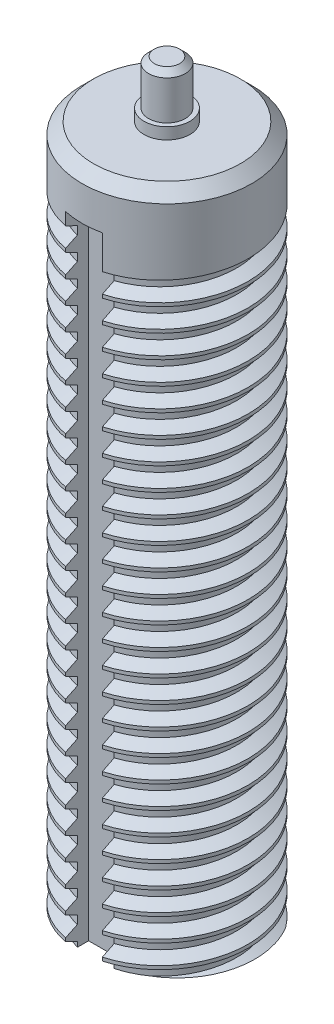
from build123d import *

# Parameters (mm, degrees)
BOSS_EXTRUDE1_DEPTH     = 70
BOSS_EXTRUDE2_START     = -4
SKETCH2_R               = 7.4
BOSS_EXTRUDE2_DEPTH     = 4
SKETCH3_R               = 2
BOSS_EXTRUDE3_DEPTH     = 1
SKETCH4_R               = 1.6
BOSS_EXTRUDE4_DEPTH     = 3.9
CHAMFER1_SIZE           = 0.5
CHAMFER2_SIZE           = 1
CUT_SWEEP2_PITCH        = 2
CUT_EXTRUDE1_DEPTH      = 76.627574787
CUT_EXTRUDE1_DEPTH_BACK = 76.627574787
SKETCH8_W               = 32.067903325
SKETCH8_H               = 12.666319182


with BuildPart() as part:
    # Sketch1 → Boss-Extrude1 (new body)
    with BuildSketch(Plane(origin=(0, 0, 0), x_dir=(1, 0, 0), z_dir=(0, 1, 0))):
        with BuildLine():
            Line((-1.6, 7.224956747), (-1.6, 5.224956747))
            Line((-1.6, 5.224956747), (1.6, 5.224956747))
            Line((1.6, 5.224956747), (1.6, 7.224956747))
            ThreePointArc((1.6, 7.224956747), (7.4, 0), (1.6, -7.224956747))
            Line((1.6, -7.224956747), (1.6, -5.224956747))
            Line((1.6, -5.224956747), (-1.6, -5.224956747))
            Line((-1.6, -5.224956747), (-1.6, -7.224956747))
            ThreePointArc((-1.6, -7.224956747), (-7.4, 0), (-1.6, 7.224956747))
        make_face()
    extrude(amount=BOSS_EXTRUDE1_DEPTH)

    # Sketch2 → Boss-Extrude2 (add)
    with BuildSketch(Plane(origin=(0, 70, 0), x_dir=(1, 0, 0), z_dir=(0, 1, 0)).offset(BOSS_EXTRUDE2_START)):
        with Locations(Location((0, 0, 0), (0, 0, 102.486889814))):
            Circle(SKETCH2_R)
    extrude(amount=BOSS_EXTRUDE2_DEPTH)

    # Sketch3 → Boss-Extrude3 (add)
    with BuildSketch(Plane(origin=(0, 70, 0), x_dir=(1, 0, 0), z_dir=(0, 1, 0))):
        with Locations(Location((0, 0, 0), (0, 0, 270))):
            Circle(SKETCH3_R)
    extrude(amount=BOSS_EXTRUDE3_DEPTH)

    # Sketch4 → Boss-Extrude4 (add)
    with BuildSketch(Plane(origin=(0, 71, 0), x_dir=(1, 0, 0), z_dir=(0, 1, 0))):
        with Locations(Location((0, 0, 0), (0, 0, 270))):
            Circle(SKETCH4_R)
    extrude(amount=BOSS_EXTRUDE4_DEPTH)

    # Chamfer1
    chamfer1_edges = [part.edges().sort_by_distance(p)[0] for p in [
        (0, 74.9, -1.6),
    ]]
    chamfer(chamfer1_edges, length=CHAMFER1_SIZE)

    # Chamfer2
    chamfer2_edges = [part.edges().sort_by_distance(p)[0] for p in [
        (7.4, 70, 0),
    ]]
    chamfer(chamfer2_edges, length=CHAMFER2_SIZE)

    # Cut-Sweep2: the profile of Sketch6 profile screwed along a right-hand helix of 32.5 turns, 10 arcs to a turn; built about Z, then put on its axis
    cut_sweep2_z = Axis((0, 0, 0), (0, 0, 1))
    cut_sweep2_corners = [(7.4003, 0, 0.00015), (7.4003, 0, -1.70015), (6.4, 0, -1.2), (6.4, 0, -0.5)]
    with BuildLine(mode=Mode.PRIVATE) as cut_sweep2_profile:
        Line(cut_sweep2_corners[0], cut_sweep2_corners[1])
        Line(cut_sweep2_corners[1], cut_sweep2_corners[2])
        Line(cut_sweep2_corners[2], cut_sweep2_corners[3])
        Line(cut_sweep2_corners[3], cut_sweep2_corners[0])
    cut_sweep2_cap = Face(cut_sweep2_profile.wire())
    cut_sweep2_turn_angles = [0, 18, 36, 54, 72, 90, 108, 126, 144, 162, 180, 198, 216, 234, 252, 270, 288, 306, 324, 342, 360]
    cut_sweep2_turn_weights = [1, 0.9510565162951535, 1, 0.9510565162951535, 1, 0.9510565162951535, 1, 0.9510565162951535, 1, 0.9510565162951535, 1, 0.9510565162951535, 1, 0.9510565162951535, 1, 0.9510565162951535, 1, 0.9510565162951535, 1, 0.9510565162951535, 1]
    cut_sweep2_turn_rails = [Edge.make_bspline([Vector(p[0], p[1], 0).rotate(cut_sweep2_z, cut_sweep2_turn_angles[k]) / cut_sweep2_turn_weights[k] + Vector(0, 0, p[2] + CUT_SWEEP2_PITCH * cut_sweep2_turn_angles[k] / 360) for k in range(21)], [0, 0, 0, 1, 1, 2, 2, 3, 3, 4, 4, 5, 5, 6, 6, 7, 7, 8, 8, 9, 9, 10, 10, 10], 2, cut_sweep2_turn_weights) for p in cut_sweep2_corners]
    cut_sweep2_turn_sides = [Face.make_surface_from_curves(cut_sweep2_turn_rails[p[0]], cut_sweep2_turn_rails[p[1]]) for p in [(0, 1), (1, 2), (2, 3), (3, 0)]]
    cut_sweep2_last_angles = [11520, 11538, 11556, 11574, 11592, 11610, 11628, 11646, 11664, 11682, 11700]
    cut_sweep2_last_weights = [1, 0.9510565162951535, 1, 0.9510565162951535, 1, 0.9510565162951535, 1, 0.9510565162951535, 1, 0.9510565162951046, 1]
    cut_sweep2_last_rails = [Edge.make_bspline([Vector(p[0], p[1], 0).rotate(cut_sweep2_z, cut_sweep2_last_angles[k]) / cut_sweep2_last_weights[k] + Vector(0, 0, p[2] + CUT_SWEEP2_PITCH * cut_sweep2_last_angles[k] / 360) for k in range(11)], [0, 0, 0, 1, 1, 2, 2, 3, 3, 4, 4, 5, 5, 5], 2, cut_sweep2_last_weights) for p in cut_sweep2_corners]
    cut_sweep2_last_sides = [Face.make_surface_from_curves(cut_sweep2_last_rails[p[0]], cut_sweep2_last_rails[p[1]]) for p in [(0, 1), (1, 2), (2, 3), (3, 0)]]
    cut_sweep2 = Plane(origin=(0, 0, 0), x_dir=(0, 0, -1), z_dir=(0, 1, 0)) * Solid(Shell([*[p.moved(Location((0, 0, CUT_SWEEP2_PITCH * i))) for i in range(32) for p in cut_sweep2_turn_sides], *cut_sweep2_last_sides, cut_sweep2_cap, cut_sweep2_cap.rotate(cut_sweep2_z, 11700).moved(Location((0, 0, CUT_SWEEP2_PITCH * 11700 / 360)))]))
    add(cut_sweep2, mode=Mode.SUBTRACT)

    # Sketch8 → Cut-Extrude1 (cut, two sides: drawn at the far end of the back side and taken through both)
    with BuildSketch(Plane.XY.offset(-CUT_EXTRUDE1_DEPTH_BACK)):
        with Locations((-0.050263172, 3.666840409)):
            Rectangle(SKETCH8_W, SKETCH8_H)
    extrude(amount=CUT_EXTRUDE1_DEPTH + CUT_EXTRUDE1_DEPTH_BACK, mode=Mode.SUBTRACT)


solid = part.part
